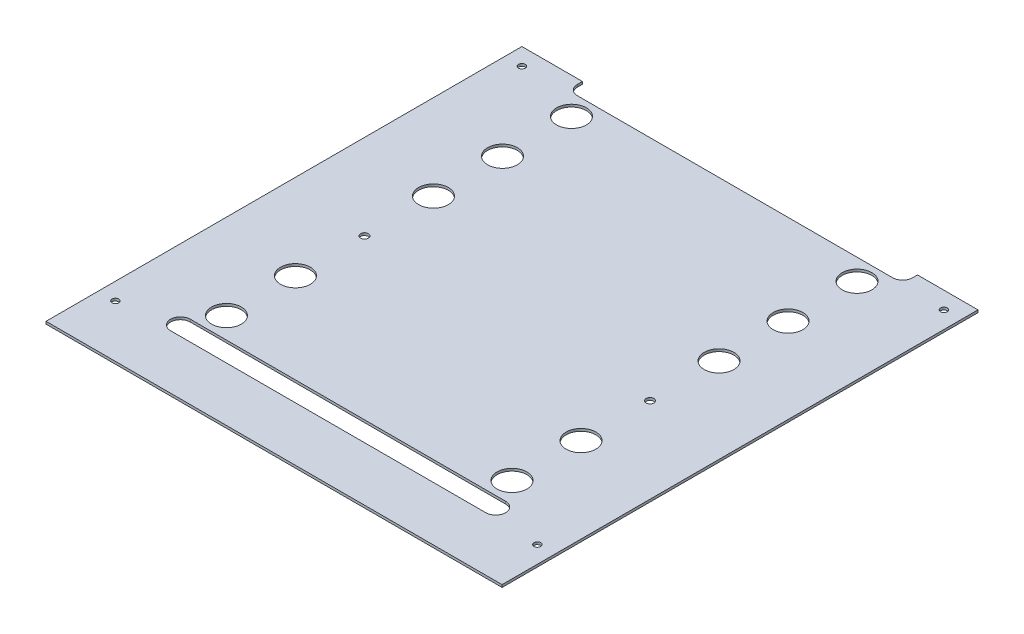
from build123d import *

# Parameters (mm, degrees)
SKETCH1_R           = 2.15265
SKETCH1_R_2         = 9.525
SKETCH1_R_3         = 2.4892
BOSS_EXTRUDE1_DEPTH = 1.5875


with BuildPart() as part:
    # Sketch1 → Boss-Extrude1 (new body)
    with BuildSketch(Plane(origin=(0, 0, 0), x_dir=(1, 0, 0), z_dir=(0, 1, 0))):
        with BuildLine():
            Line((-107.315, 152.4), (-146.05, 152.4))
            Line((-146.05, 152.4), (-146.05, -152.4))
            Line((-146.05, -152.4), (146.05, -152.4))
            Line((146.05, -152.4), (146.05, 152.4))
            Line((146.05, 152.4), (107.315, 152.4))
            Line((107.315, 152.4), (107.315, 149.225))
            ThreePointArc((107.315, 149.225), (105.455128061, 144.734871939), (100.965, 142.875))
            Line((100.965, 142.875), (-100.965, 142.875))
            ThreePointArc((-100.965, 142.875), (-105.455128061, 144.734871939), (-107.315, 149.225))
            Line((-107.315, 149.225), (-107.315, 152.4))
        make_face()
        with Locations((-135.128, -118.872)):
            Circle(SKETCH1_R, mode=Mode.SUBTRACT)
        with Locations((-91.44, -91.44)):
            Circle(SKETCH1_R_2, mode=Mode.SUBTRACT)
        with Locations((-91.44, -47.244)):
            Circle(SKETCH1_R_2, mode=Mode.SUBTRACT)
        with Locations((-91.44, -3.048)):
            Circle(SKETCH1_R_3, mode=Mode.SUBTRACT)
        with BuildLine():
            ThreePointArc((-100.965, -117.729), (-107.315, -111.379), (-100.965, -105.029))
            Line((-100.965, -105.029), (100.965, -105.029))
            ThreePointArc((100.965, -105.029), (107.315, -111.379), (100.965, -117.729))
            Line((100.965, -117.729), (-100.965, -117.729))
        make_face(mode=Mode.SUBTRACT)
        with Locations((135.128, -118.872)):
            Circle(SKETCH1_R, mode=Mode.SUBTRACT)
        with Locations((91.44, -91.44)):
            Circle(SKETCH1_R_2, mode=Mode.SUBTRACT)
        with Locations((91.44, -47.244)):
            Circle(SKETCH1_R_2, mode=Mode.SUBTRACT)
        with Locations((91.44, -3.048)):
            Circle(SKETCH1_R_3, mode=Mode.SUBTRACT)
        with Locations((-91.44, 41.148)):
            Circle(SKETCH1_R_2, mode=Mode.SUBTRACT)
        with Locations((-91.44, 85.344)):
            Circle(SKETCH1_R_2, mode=Mode.SUBTRACT)
        with Locations((-135.128, 141.478)):
            Circle(SKETCH1_R, mode=Mode.SUBTRACT)
        with Locations((-91.44, 129.54)):
            Circle(SKETCH1_R_2, mode=Mode.SUBTRACT)
        with Locations((91.44, 41.148)):
            Circle(SKETCH1_R_2, mode=Mode.SUBTRACT)
        with Locations((91.44, 85.344)):
            Circle(SKETCH1_R_2, mode=Mode.SUBTRACT)
        with Locations((91.44, 129.54)):
            Circle(SKETCH1_R_2, mode=Mode.SUBTRACT)
        with Locations((135.128, 141.478)):
            Circle(SKETCH1_R, mode=Mode.SUBTRACT)
    extrude(amount=BOSS_EXTRUDE1_DEPTH)


solid = part.part
